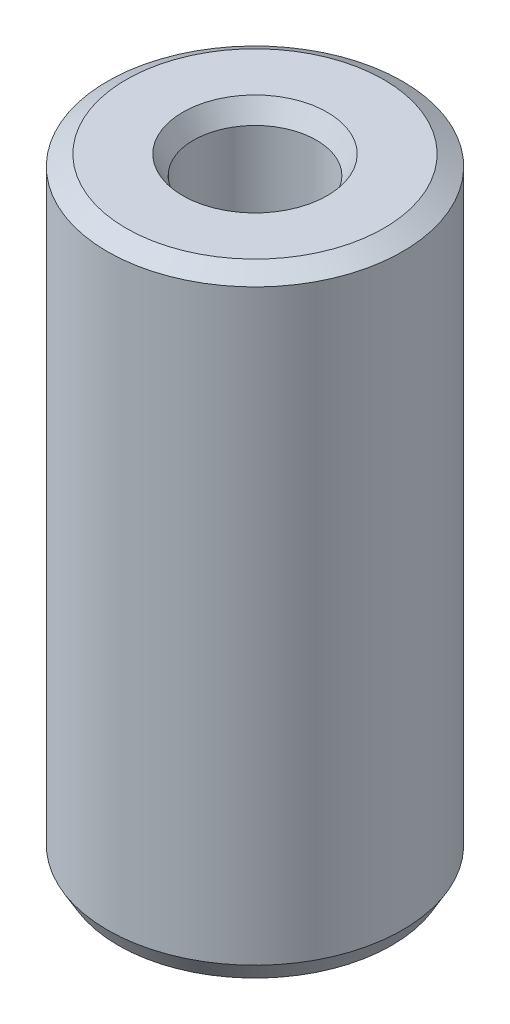
from build123d import *
from OCP.BRepFilletAPI import BRepFilletAPI_MakeChamfer

# Parameters (mm, degrees)
SKETCH1_R           = 35
BOSS_EXTRUDE1_DEPTH = 146.353367314
SKETCH2_R           = 14.579359838
CUT_EXTRUDE1_DEPTH  = 155.496951828
CHAMFER1_SIZE       = 2.569309035
CHAMFER1_SIZE2      = 4.450173788


with BuildPart() as part:
    # Sketch1 → Boss-Extrude1 (new body)
    with BuildSketch(Plane(origin=(0, 0, 0), x_dir=(1, 0, 0), z_dir=(0, 1, 0))):
        Circle(SKETCH1_R)
    extrude(amount=BOSS_EXTRUDE1_DEPTH)

    # Sketch2 → Cut-Extrude1 (cut, through all)
    with BuildSketch(Plane(origin=(0, 0, 0), x_dir=(1, 0, 0), z_dir=(0, 1, 0))):
        Circle(SKETCH2_R)
    extrude(amount=CUT_EXTRUDE1_DEPTH, mode=Mode.SUBTRACT)

    # Chamfer1: one chamfer whose edges measure the first distance from different faces: ONE call of the kernel's chamfer builder (chamfer() names one face for all edges)
    chamfer1_edges_1 = [part.edges().sort_by_distance(p)[0] for p in [
        (-14.579359838, 146.353367314, 0),
    ]]
    chamfer1_side_1 = [part.faces().sort_by_distance(p)[0] for p in [
        (-34.010050506, 146.353367314, 0),
    ]]
    chamfer1_edges_2 = [part.edges().sort_by_distance(p)[0] for p in [
        (-14.579359838, 0, 0),
    ]]
    chamfer1_side_2 = [part.faces().sort_by_distance(p)[0] for p in [
        (-14.579359838, 73.176683657, 0),
    ]]
    chamfer1_edges_3 = [part.edges().sort_by_distance(p)[0] for p in [
        (-35, 0, 0),
    ]]
    chamfer1_side_3 = [part.faces().sort_by_distance(p)[0] for p in [
        (-34.010050506, 0, 0),
    ]]
    chamfer1_edges_4 = [part.edges().sort_by_distance(p)[0] for p in [
        (-35, 146.353367314, 0),
    ]]
    chamfer1_side_4 = [part.faces().sort_by_distance(p)[0] for p in [
        (-35, 73.176683657, 0),
    ]]
    chamfer1 = BRepFilletAPI_MakeChamfer(part.part.solid().wrapped)
    for e in chamfer1_edges_1:
        chamfer1.Add(CHAMFER1_SIZE, CHAMFER1_SIZE2, e.wrapped, chamfer1_side_1[0].wrapped)  # the first distance lies on this face
    for e in chamfer1_edges_2:
        chamfer1.Add(CHAMFER1_SIZE, CHAMFER1_SIZE2, e.wrapped, chamfer1_side_2[0].wrapped)  # the first distance lies on this face
    for e in chamfer1_edges_3:
        chamfer1.Add(CHAMFER1_SIZE, CHAMFER1_SIZE2, e.wrapped, chamfer1_side_3[0].wrapped)  # the first distance lies on this face
    for e in chamfer1_edges_4:
        chamfer1.Add(CHAMFER1_SIZE, CHAMFER1_SIZE2, e.wrapped, chamfer1_side_4[0].wrapped)  # the first distance lies on this face
    add(Compound.cast(chamfer1.Shape()), mode=Mode.REPLACE)


solid = part.part
